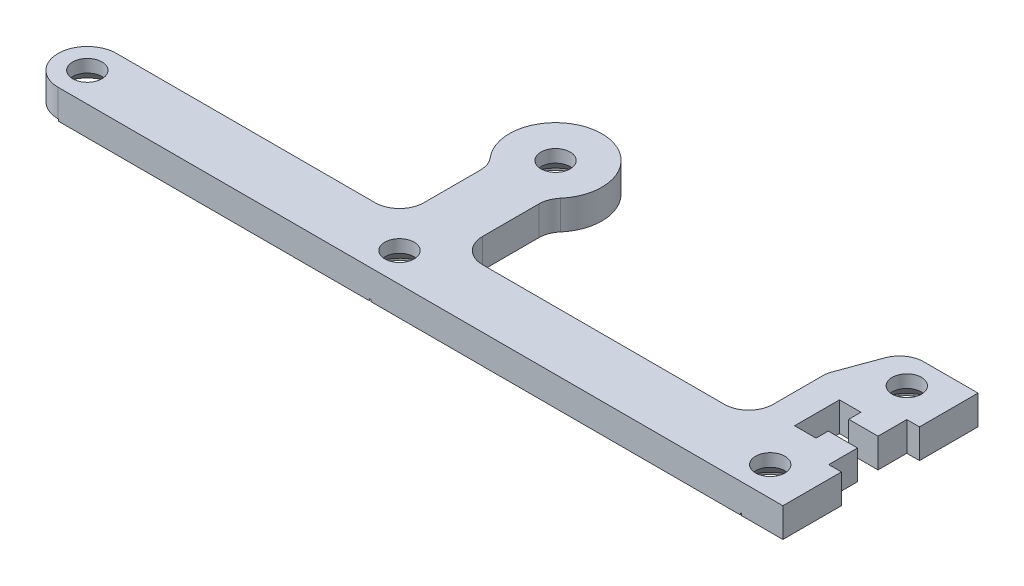
from build123d import *

# Parameters (mm, degrees)
SKETCH1_R                                      = 1.5
BOSS_EXTRUDE1_DEPTH                            = 3
FILLET1_R                                      = 2.5
CSK_FOR_M3_FLAT_HEAD_MACHINE_SCREW2_AT_2_COUNT = 2
CSK_FOR_M3_FLAT_HEAD_MACHINE_SCREW2_AT_2_PITCH = 32
CSK_FOR_M3_FLAT_HEAD_MACHINE_SCREW2_AT_3_COUNT = 2
CSK_FOR_M3_FLAT_HEAD_MACHINE_SCREW2_AT_3_PITCH = 70
CSK_FOR_M3_FLAT_HEAD_MACHINE_SCREW2_AT_4_COUNT = 2
CSK_FOR_M3_FLAT_HEAD_MACHINE_SCREW2_AT_4_PITCH = 71.38627319
CSK_FOR_M3_FLAT_HEAD_MACHINE_SCREW2_AT_5_COUNT = 2
CSK_FOR_M3_FLAT_HEAD_MACHINE_SCREW2_AT_5_PITCH = 35.77708764


with BuildPart() as part:
    # Sketch1 → Boss-Extrude1 (new body)
    with BuildSketch(Plane(origin=(0, 0, 0), x_dir=(1, 0, 0), z_dir=(0, 1, 0))):
        with BuildLine():
            Line((-3, -13), (-32, -13))
            ThreePointArc((-32, -13), (-35, -16), (-32, -19))
            Line((-32, -19), (42.3, -19))
            Line((42.3, -19), (42.3, -13))
            Line((42.3, -13), (41, -13))
            Line((41, -13), (41, -10.05))
            Line((41, -10.05), (38, -10.05))
            Line((38, -10.05), (38, -11.3))
            Line((38, -11.3), (35.8, -11.3))
            Line((35.8, -11.3), (35.8, -6.7))
            Line((35.8, -6.7), (38, -6.7))
            Line((38, -6.7), (38, -7.95))
            Line((38, -7.95), (41, -7.95))
            Line((41, -7.95), (41, -5))
            Line((41, -5), (42.3, -5))
            Line((42.3, -5), (42.3, 1))
            Line((42.3, 1), (35, 1))
            Line((35, 1), (32.8, -5))
            Line((32.8, -5), (32.8, -13))
            Line((32.8, -13), (3, -13))
            Line((3, -13), (3, -3.682729966))
            ThreePointArc((3, -3.682729966), (0, 4.75), (-3, -3.682729966))
            Line((-3, -3.682729966), (-3, -13))
        make_face()
        with Locations((0, -16)):
            Circle(SKETCH1_R, mode=Mode.SUBTRACT)
        with Locations((-32, -16)):
            Circle(SKETCH1_R, mode=Mode.SUBTRACT)
        Circle(SKETCH1_R, mode=Mode.SUBTRACT)
        with Locations((38, -16)):
            Circle(SKETCH1_R, mode=Mode.SUBTRACT)
        with Locations((38, -2)):
            Circle(SKETCH1_R, mode=Mode.SUBTRACT)
    extrude(amount=BOSS_EXTRUDE1_DEPTH)

    # Fillet1
    fillet1_edges = [part.edges().sort_by_distance(p)[0] for p in [
        (35, 1.5, -1),
        (32.8, 1.5, 5),
        (32.8, 1.5, 13),
        (3, 1.5, 13),
        (-3, 1.5, 13),
        (-3, 1.5, 3.682729966),
        (3, 1.5, 3.682729966),
    ]]
    fillet(fillet1_edges, radius=FILLET1_R)

    # Sketch3 → CSK for M3 Flat Head Machine Screw2 (revolve, cut)
    with BuildSketch(Plane(origin=(-32, 0, 16), x_dir=(0, 0, -1), z_dir=(1, 0, 0))):
        Polygon((0, 0), (0, 3), (1.5, 3), (1.5, 1.7005), (3.0005, 0.2), (3.0005, 0), align=None)
    csk_for_m3_flat_head_machine_screw2 = revolve(axis=Axis((-32, -6.35, 16), (0, 1, 0)), mode=Mode.SUBTRACT)

    # CSK for M3 Flat Head Machine Screw2 at 2: CSK for M3 Flat Head Machine Screw2 ×2
    with Locations(*[(i * CSK_FOR_M3_FLAT_HEAD_MACHINE_SCREW2_AT_2_PITCH, 0, 0) for i in range(1, CSK_FOR_M3_FLAT_HEAD_MACHINE_SCREW2_AT_2_COUNT)]):
        add(csk_for_m3_flat_head_machine_screw2, mode=Mode.SUBTRACT)

    # CSK for M3 Flat Head Machine Screw2 at 3: CSK for M3 Flat Head Machine Screw2 ×2
    with Locations(*[(i * CSK_FOR_M3_FLAT_HEAD_MACHINE_SCREW2_AT_3_PITCH, 0, 0) for i in range(1, CSK_FOR_M3_FLAT_HEAD_MACHINE_SCREW2_AT_3_COUNT)]):
        add(csk_for_m3_flat_head_machine_screw2, mode=Mode.SUBTRACT)

    # CSK for M3 Flat Head Machine Screw2 at 4: CSK for M3 Flat Head Machine Screw2 ×2
    with Locations(*[Vector(0.9805806756909202, 0, -0.1961161351381841) * (i * CSK_FOR_M3_FLAT_HEAD_MACHINE_SCREW2_AT_4_PITCH) for i in range(1, CSK_FOR_M3_FLAT_HEAD_MACHINE_SCREW2_AT_4_COUNT)]):
        add(csk_for_m3_flat_head_machine_screw2, mode=Mode.SUBTRACT)

    # CSK for M3 Flat Head Machine Screw2 at 5: CSK for M3 Flat Head Machine Screw2 ×2
    with Locations(*[Vector(0.8944271909999157, 0, -0.44721359549995826) * (i * CSK_FOR_M3_FLAT_HEAD_MACHINE_SCREW2_AT_5_PITCH) for i in range(1, CSK_FOR_M3_FLAT_HEAD_MACHINE_SCREW2_AT_5_COUNT)]):
        add(csk_for_m3_flat_head_machine_screw2, mode=Mode.SUBTRACT)


solid = part.part
